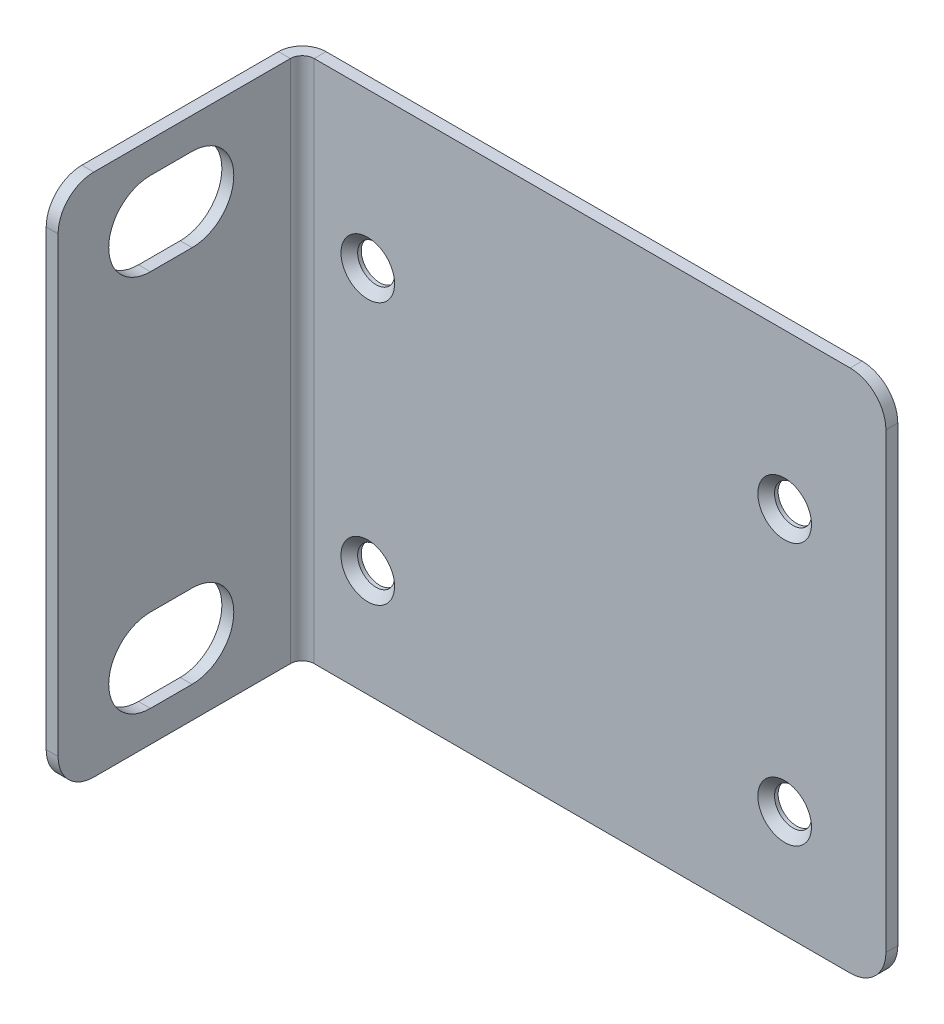
from build123d import *

# Parameters (mm, degrees)
SM_BASE_FLANGE_1_DEPTH           = 22
FILLET_1_R                       = 3
HOLE_WIZARD_6_8_6_8_1_DEPTH      = 1
HOLE_WIZARD_3_1_3_1_1_AT_2_COUNT = 2
HOLE_WIZARD_3_1_3_1_1_AT_2_PITCH = 41.340053217
HOLE_WIZARD_3_1_3_1_1_AT_3_COUNT = 2
HOLE_WIZARD_3_1_3_1_1_AT_3_PITCH = 22
HOLE_WIZARD_3_1_3_1_1_AT_4_COUNT = 2
HOLE_WIZARD_3_1_3_1_1_AT_4_PITCH = 35


# Read off the part's stored shape, not the designer's step: Диаметр отверстия Ø6.8 (6.8)1
# Sheet-metal steps are written as plain solids
with BuildPart() as part:
    # Sketch 1 → Базовая кромка1 (new, symmetric)
    with BuildSketch(Plane(origin=(0, 0, 0), x_dir=(1, 0, 0), z_dir=(0, 1, 0))):
        with BuildLine():
            Line((0, -21.5), (0, -2))
            ThreePointArc((0, -2), (0.585786438, -0.585786438), (2, 0))
            Line((2, 0), (50, 0))
            Line((50, 0), (50, -1))
            Line((50, -1), (2, -1))
            ThreePointArc((2, -1), (1.292893219, -1.292893219), (1, -2))
            Line((1, -2), (1, -21.5))
            Line((1, -21.5), (0, -21.5))
        make_face()
    extrude(amount=SM_BASE_FLANGE_1_DEPTH, both=True)

    # Скругление1
    fillet_1_edges = [part.edges().sort_by_distance(p)[0] for p in [
        (0.5, 22, 21.5),
        (0.5, -22, 21.5),
        (50, 22, 0.5),
        (50, -22, 0.5),
    ]]
    fillet(fillet_1_edges, radius=FILLET_1_R)

    # Диаметр отверстия Ø6.8 (6.8)1 outline → Диаметр отверстия Ø6.8 (6.8)1 (cut)
    with BuildSketch(Plane.YZ):
        with BuildLine():
            Line((-12.375, 10.25), (-12.375, 13.75))
            ThreePointArc((-12.375, 13.75), (-15.875, 17.25), (-19.375, 13.75))
            Line((-19.375, 13.75), (-19.375, 10.25))
            ThreePointArc((-19.375, 10.25), (-15.875, 6.75), (-12.375, 10.25))
        make_face()
        with BuildLine():
            ThreePointArc((19.375, 13.75), (15.875, 17.25), (12.375, 13.75))
            Line((12.375, 13.75), (12.375, 10.25))
            ThreePointArc((12.375, 10.25), (15.875, 6.75), (19.375, 10.25))
            Line((19.375, 10.25), (19.375, 13.75))
        make_face()
    extrude(amount=HOLE_WIZARD_6_8_6_8_1_DEPTH, mode=Mode.SUBTRACT)

    # Эскиз5 → Диаметр отверстия Ø3.1 (3.1)1 (revolve, cut)
    with BuildSketch(Plane(origin=(6.5, 9, 1), x_dir=(0, -1, 0), z_dir=(1, 0, 0))):
        Polygon((0, 0), (0, 1), (1.55, 1), (1.55, 0.7), (2.25, 0), align=None)
    hole_wizard_3_1_3_1_1 = revolve(axis=Axis((6.5, 9, 7.35), (0, 0, -1)), mode=Mode.SUBTRACT)

    # Диаметр отверстия Ø3.1 (3.1)1 at 2: Диаметр отверстия Ø3.1 (3.1)1 ×2
    with Locations(*[Vector(0.8466365492110047, -0.5321715452183459, 0) * (i * HOLE_WIZARD_3_1_3_1_1_AT_2_PITCH) for i in range(1, HOLE_WIZARD_3_1_3_1_1_AT_2_COUNT)]):
        add(hole_wizard_3_1_3_1_1, mode=Mode.SUBTRACT)

    # Диаметр отверстия Ø3.1 (3.1)1 at 3: Диаметр отверстия Ø3.1 (3.1)1 ×2
    with Locations(*[(0, -i * HOLE_WIZARD_3_1_3_1_1_AT_3_PITCH, 0) for i in range(1, HOLE_WIZARD_3_1_3_1_1_AT_3_COUNT)]):
        add(hole_wizard_3_1_3_1_1, mode=Mode.SUBTRACT)

    # Диаметр отверстия Ø3.1 (3.1)1 at 4: Диаметр отверстия Ø3.1 (3.1)1 ×2
    with Locations(*[(i * HOLE_WIZARD_3_1_3_1_1_AT_4_PITCH, 0, 0) for i in range(1, HOLE_WIZARD_3_1_3_1_1_AT_4_COUNT)]):
        add(hole_wizard_3_1_3_1_1, mode=Mode.SUBTRACT)


solid = part.part
